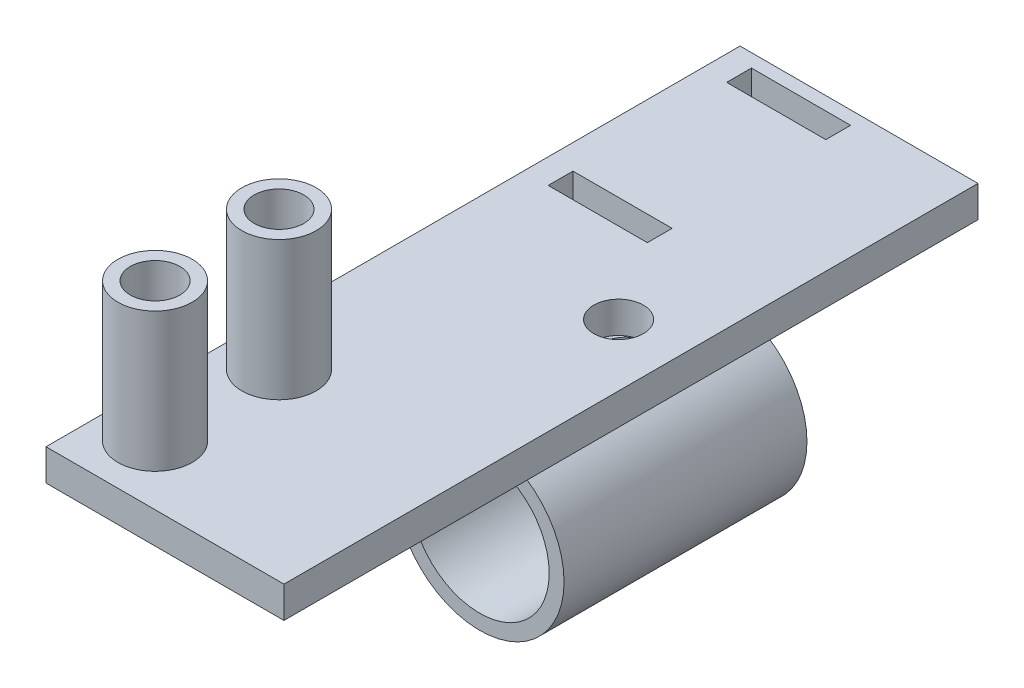
from build123d import *

# Parameters (mm, degrees)
SKETCH1_W                = 48
SKETCH1_H                = 140
SKETCH1_R                = 5
SKETCH1_W_2              = 20
SKETCH1_H_2              = 5
BASE_FLANGE1_DEPTH       = 6.35
SKETCH6_R                = 7.5
SKETCH6_R_2              = 5
BOSS_EXTRUDE1_DEPTH      = 28
BOSS_EXTRUDE2_DEPTH      = 28
BOSS_EXTRUDE2_DEPTH_BACK = 21
SKETCH7_R                = 17
SKETCH7_R_2              = 14
SKETCH8_R                = 5
CUT_EXTRUDE1_DEPTH       = 97.376202976


# Sheet-metal steps are written as plain solids
with BuildPart() as part:
    # Sketch1 → Base-Flange1 (new body)
    with BuildSketch(Plane(origin=(0, 0, 0), x_dir=(1, 0, 0), z_dir=(0, 1, 0))):
        with Locations((-11.5, -10)):
            Rectangle(SKETCH1_W, SKETCH1_H)
        with Locations(Location((0, 0, 0), (0, 0, 270))):
            Circle(SKETCH1_R, mode=Mode.SUBTRACT)
        with Locations((-20.5, 54.8)):
            Rectangle(SKETCH1_W_2, SKETCH1_H_2, mode=Mode.SUBTRACT)
        with Locations((-20.5, 18.8)):
            Rectangle(SKETCH1_W_2, SKETCH1_H_2, mode=Mode.SUBTRACT)
    extrude(amount=-BASE_FLANGE1_DEPTH)

    # Sketch6 → Boss-Extrude1 (add)
    # profile 1 of 2: a face of its own
    with BuildSketch(Plane(origin=(0, 0, 0), x_dir=(1, 0, 0), z_dir=(0, 1, 0))):
        with Locations(Location((-25.5, -68, 0), (0, 0, 90))):
            Circle(SKETCH6_R)
        with Locations(Location((-25.5, -68, 0), (0, 0, 90))):
            Circle(SKETCH6_R_2, mode=Mode.SUBTRACT)
    # profile 2 of 2: a face of its own
    with BuildSketch(Plane(origin=(0, 0, 0), x_dir=(1, 0, 0), z_dir=(0, 1, 0))):
        with Locations(Location((-25.5, -43, 0), (0, 0, 90))):
            Circle(SKETCH6_R)
        with Locations(Location((-25.5, -43, 0), (0, 0, 90))):
            Circle(SKETCH6_R_2, mode=Mode.SUBTRACT)
    extrude(amount=BOSS_EXTRUDE1_DEPTH)


with BuildPart() as body_2:
    # Sketch7 → Boss-Extrude2 (new, two sides: drawn at the far end of the back side and taken through both)
    with BuildSketch(Plane.XY.offset(-BOSS_EXTRUDE2_DEPTH_BACK)):
        with Locations((0, -23.35)):
            Circle(SKETCH7_R)
        with Locations((0, -23.35)):
            Circle(SKETCH7_R_2, mode=Mode.SUBTRACT)
    extrude(amount=BOSS_EXTRUDE2_DEPTH + BOSS_EXTRUDE2_DEPTH_BACK)

    # Sketch8 → Cut-Extrude1 (cut, through all)
    with BuildSketch(Plane(origin=(0, 0, 0), x_dir=(1, 0, 0), z_dir=(0, 1, 0))):
        with Locations(Location((0, 0, 0), (0, 0, 270))):
            Circle(SKETCH8_R)
    extrude(amount=-CUT_EXTRUDE1_DEPTH, mode=Mode.SUBTRACT)


solid = Compound([part.part, body_2.part])
